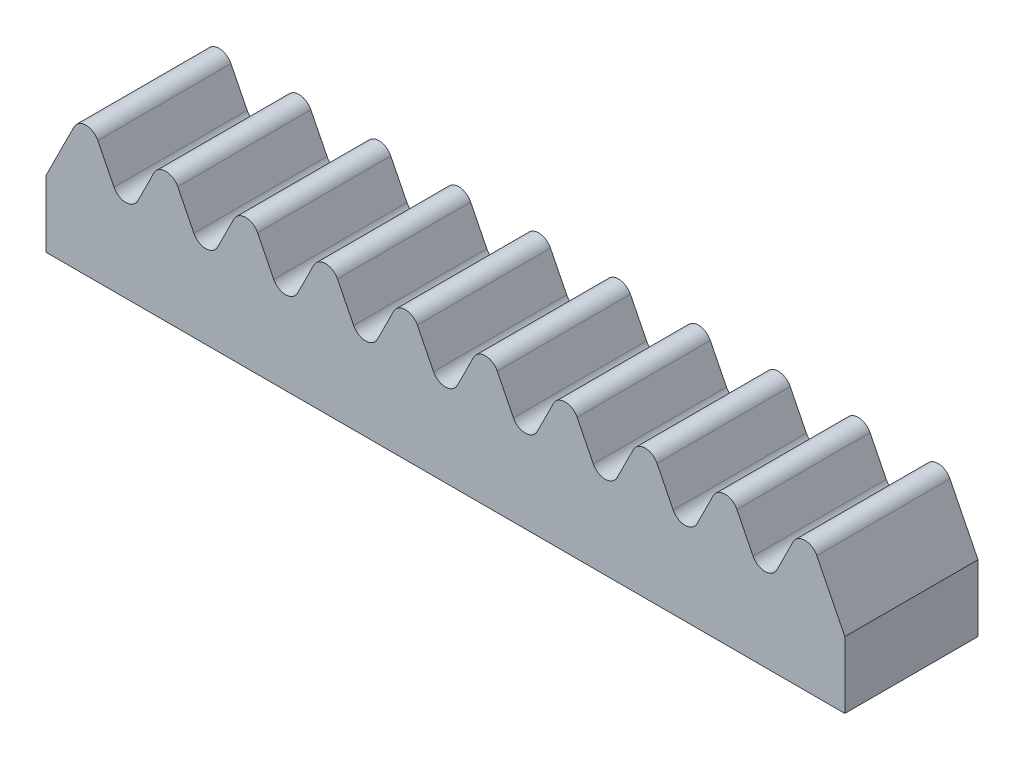
from build123d import *

# Parameters (mm, degrees)
BOSS_EXTRUDE1_DEPTH = 5


with BuildPart() as part:
    # Sketch2 → Boss-Extrude1 (new body)
    with BuildSketch(Plane.XY):
        with BuildLine():
            Line((-12, 2.5), (-12, 0))
            Line((-12, 0), (18, 0))
            Line((18, 0), (18, 2.5))
            Line((18, 2.5), (16.947213595, 4.605572809))
            ThreePointArc((16.947213595, 4.605572809), (16.5, 4.881966011), (16.052786405, 4.605572809))
            Line((16.052786405, 4.605572809), (15.447213595, 3.394427191))
            ThreePointArc((15.447213595, 3.394427191), (15, 3.118033989), (14.552786405, 3.394427191))
            Line((14.552786405, 3.394427191), (13.947213595, 4.605572809))
            ThreePointArc((13.947213595, 4.605572809), (13.5, 4.881966011), (13.052786405, 4.605572809))
            Line((13.052786405, 4.605572809), (12.447213595, 3.394427191))
            ThreePointArc((12.447213595, 3.394427191), (12, 3.118033989), (11.552786405, 3.394427191))
            Line((11.552786405, 3.394427191), (10.947213595, 4.605572809))
            ThreePointArc((10.947213595, 4.605572809), (10.5, 4.881966011), (10.052786405, 4.605572809))
            Line((10.052786405, 4.605572809), (9.447213595, 3.394427191))
            ThreePointArc((9.447213595, 3.394427191), (9, 3.118033989), (8.552786405, 3.394427191))
            Line((8.552786405, 3.394427191), (7.947213595, 4.605572809))
            ThreePointArc((7.947213595, 4.605572809), (7.5, 4.881966011), (7.052786405, 4.605572809))
            Line((7.052786405, 4.605572809), (6.447213595, 3.394427191))
            ThreePointArc((6.447213595, 3.394427191), (6, 3.118033989), (5.552786405, 3.394427191))
            Line((5.552786405, 3.394427191), (4.947213595, 4.605572809))
            ThreePointArc((4.947213595, 4.605572809), (4.5, 4.881966011), (4.052786405, 4.605572809))
            Line((4.052786405, 4.605572809), (3.447213595, 3.394427191))
            ThreePointArc((3.447213595, 3.394427191), (3, 3.118033989), (2.552786405, 3.394427191))
            Line((2.552786405, 3.394427191), (1.947213595, 4.605572809))
            ThreePointArc((1.947213595, 4.605572809), (1.5, 4.881966011), (1.052786405, 4.605572809))
            Line((1.052786405, 4.605572809), (0.447213595, 3.394427191))
            ThreePointArc((0.447213595, 3.394427191), (0, 3.118033989), (-0.447213595, 3.394427191))
            Line((-0.447213595, 3.394427191), (-1.052786405, 4.605572809))
            ThreePointArc((-1.052786405, 4.605572809), (-1.5, 4.881966011), (-1.947213595, 4.605572809))
            Line((-1.947213595, 4.605572809), (-2.552786405, 3.394427191))
            ThreePointArc((-2.552786405, 3.394427191), (-3, 3.118033989), (-3.447213595, 3.394427191))
            Line((-3.447213595, 3.394427191), (-4.052786405, 4.605572809))
            ThreePointArc((-4.052786405, 4.605572809), (-4.5, 4.881966011), (-4.947213595, 4.605572809))
            Line((-4.947213595, 4.605572809), (-5.552786405, 3.394427191))
            ThreePointArc((-5.552786405, 3.394427191), (-6, 3.118033989), (-6.447213595, 3.394427191))
            Line((-6.447213595, 3.394427191), (-7.052786405, 4.605572809))
            ThreePointArc((-7.052786405, 4.605572809), (-7.5, 4.881966011), (-7.947213595, 4.605572809))
            Line((-7.947213595, 4.605572809), (-8.552786405, 3.394427191))
            ThreePointArc((-8.552786405, 3.394427191), (-9, 3.118033989), (-9.447213595, 3.394427191))
            Line((-9.447213595, 3.394427191), (-10.052786405, 4.605572809))
            ThreePointArc((-10.052786405, 4.605572809), (-10.5, 4.881966011), (-10.947213595, 4.605572809))
            Line((-10.947213595, 4.605572809), (-11.552786405, 3.394427191))
            Line((-11.552786405, 3.394427191), (-12, 2.5))
        make_face()
    extrude(amount=BOSS_EXTRUDE1_DEPTH)


solid = part.part
